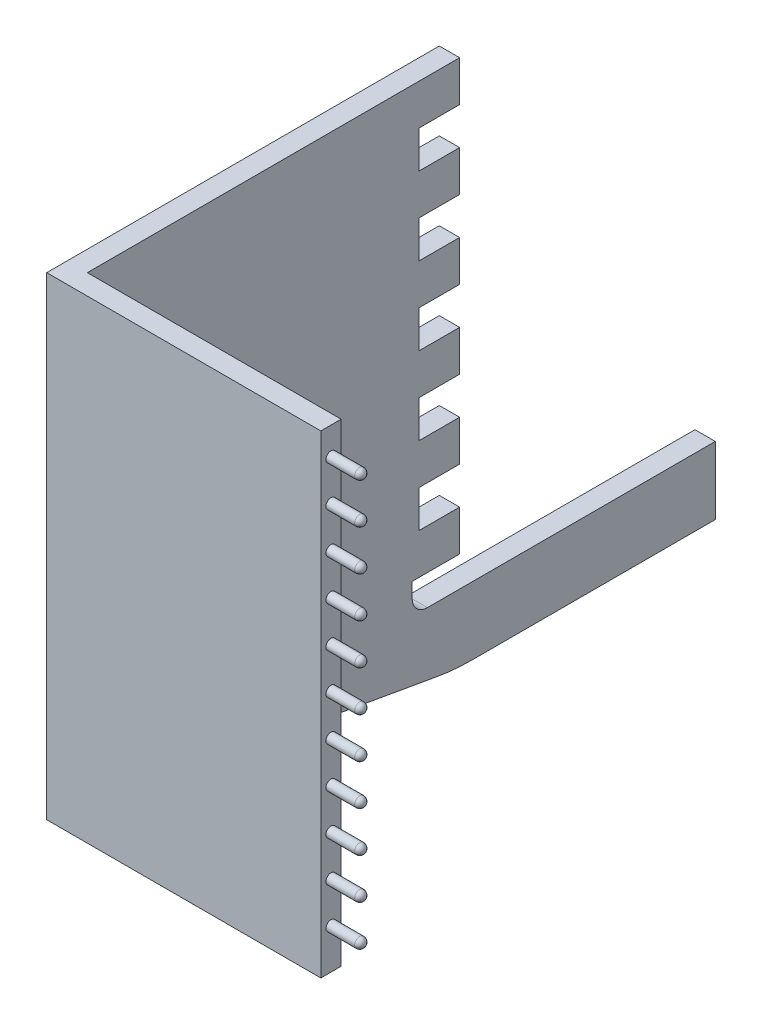
from build123d import *

# Parameters (mm, degrees)
CROQUIS1_W                 = 40.5
CROQUIS1_H                 = 70
SALIENTE_EXTRUIR1_DEPTH    = 3
CROQUIS2_W                 = 3
CROQUIS2_H                 = 70
SALIENTE_EXTRUIR2_DEPTH    = 30
CROQUIS3_R                 = 0.75
SALIENTE_EXTRUIR3_DEPTH    = 5
REDONDEO5_R                = 0.75
CROQUIS4_W                 = 25
CROQUIS4_H                 = 70
SALIENTE_EXTRUIR5_DEPTH    = 3
CROQUIS5_W                 = 3
CROQUIS5_H                 = 5.5
CORTAR_EXTRUIR1_DEPTH      = 6
SALIENTE_EXTRUIR6_DEPTH    = 3
CORTAR_EXTRUIR2_DEPTH      = 112.914904866
CORTAR_EXTRUIR2_DEPTH_BACK = 112.914904866


with BuildPart() as part:
    # Croquis1 → Saliente-Extruir1 (new body)
    with BuildSketch(Plane.XY):
        Rectangle(CROQUIS1_W, CROQUIS1_H)
    extrude(amount=SALIENTE_EXTRUIR1_DEPTH)

    # Croquis2 → Saliente-Extruir2 (add)
    with BuildSketch(Plane(origin=(0, 0, 0), x_dir=(-1, 0, 0), z_dir=(0, 0, -1))):
        with Locations((18.75, 0)):
            Rectangle(CROQUIS2_W, CROQUIS2_H)
    extrude(amount=SALIENTE_EXTRUIR2_DEPTH)

    # Croquis3 → Saliente-Extruir3 (add)
    with BuildSketch(Plane(origin=(20.25, 0, 0), x_dir=(0, 0, -1), z_dir=(1, 0, 0))):
        with Locations((-1.5, 30.956893841)):
            Circle(CROQUIS3_R)
        with Locations((-1.5, 24.956893841)):
            Circle(CROQUIS3_R)
        with Locations((-1.5, 18.956893841)):
            Circle(CROQUIS3_R)
        with Locations((-1.5, 12.956893841)):
            Circle(CROQUIS3_R)
        with Locations((-1.5, 6.956893841)):
            Circle(CROQUIS3_R)
        with Locations((-1.5, 0.956893841)):
            Circle(CROQUIS3_R)
        with Locations((-1.5, -5.043106159)):
            Circle(CROQUIS3_R)
        with Locations((-1.5, -11.043106159)):
            Circle(CROQUIS3_R)
        with Locations((-1.5, -17.043106159)):
            Circle(CROQUIS3_R)
        with Locations((-1.5, -23.043106159)):
            Circle(CROQUIS3_R)
        with Locations((-1.5, -29.043106159)):
            Circle(CROQUIS3_R)
    extrude(amount=SALIENTE_EXTRUIR3_DEPTH)

    # Redondeo5
    redondeo5_edges = [part.edges().sort_by_distance(p)[0] for p in [
        (25.25, 30.956893841, 2.25),
        (25.25, -29.043106159, 2.25),
        (25.25, -23.043106159, 2.25),
        (25.25, -17.043106159, 2.25),
        (25.25, -11.043106159, 2.25),
        (25.25, -5.043106159, 2.25),
        (25.25, 0.956893841, 2.25),
        (25.25, 6.956893841, 2.25),
        (25.25, 12.956893841, 2.25),
        (25.25, 18.956893841, 2.25),
        (25.25, 24.956893841, 2.25),
    ]]
    fillet(redondeo5_edges, radius=REDONDEO5_R)

    # Croquis4 → Saliente-Extruir5 (add)
    with BuildSketch(Plane(origin=(-17.25, 0, 0), x_dir=(0, 0, -1), z_dir=(1, 0, 0))):
        with Locations((42.5, 0)):
            Rectangle(CROQUIS4_W, CROQUIS4_H)
    extrude(amount=-SALIENTE_EXTRUIR5_DEPTH)

    # Croquis5 → Cortar-Extruir1 (cut)
    with BuildSketch(Plane(origin=(0, 0, -55), x_dir=(-1, 0, 0), z_dir=(0, 0, -1))):
        with Locations((18.75, 26.25)):
            Rectangle(CROQUIS5_W, CROQUIS5_H)
        with Locations((18.75, 14.75)):
            Rectangle(CROQUIS5_W, CROQUIS5_H)
        with Locations((18.75, 3.25)):
            Rectangle(CROQUIS5_W, CROQUIS5_H)
        with Locations((18.75, -8.25)):
            Rectangle(CROQUIS5_W, CROQUIS5_H)
        with Locations((18.75, -19.75)):
            Rectangle(CROQUIS5_W, CROQUIS5_H)
    extrude(amount=-CORTAR_EXTRUIR1_DEPTH, mode=Mode.SUBTRACT)

    # Croquis7 → Saliente-Extruir6 (add)
    with BuildSketch(Plane.ZY.offset(20.25)):
        with BuildLine():
            Line((-9, -35), (-51.686221701, -42.52673259))
            ThreePointArc((-51.686221701, -42.52673259), (-54.280994748, -42.868340943), (-56.895667031, -42.9825))
            Line((-56.895667031, -42.9825), (-92.775, -42.9825))
            Line((-92.775, -42.9825), (-92.775, -32.9825))
            Line((-92.775, -32.9825), (-50.25, -32.9825))
            Line((-50.25, -32.9825), (-9, -35))
        make_face()
    extrude(amount=-SALIENTE_EXTRUIR6_DEPTH)

    # Croquis8 → Cortar-Extruir2 (cut, two sides: drawn at the far end of the back side and taken through both)
    with BuildSketch(Plane.ZY.offset(20.25).offset(-CORTAR_EXTRUIR2_DEPTH_BACK)):
        with BuildLine():
            Line((-48, -28.5), (-48, -30.7325))
            ThreePointArc((-48, -30.7325), (-48.659009742, -32.323490258), (-50.25, -32.9825))
            Line((-50.25, -32.9825), (-92.775, -32.9825))
            Line((-92.775, -32.9825), (-92.775, -28.5))
            Line((-92.775, -28.5), (-48, -28.5))
        make_face()
    extrude(amount=CORTAR_EXTRUIR2_DEPTH + CORTAR_EXTRUIR2_DEPTH_BACK, mode=Mode.SUBTRACT)


solid = part.part
